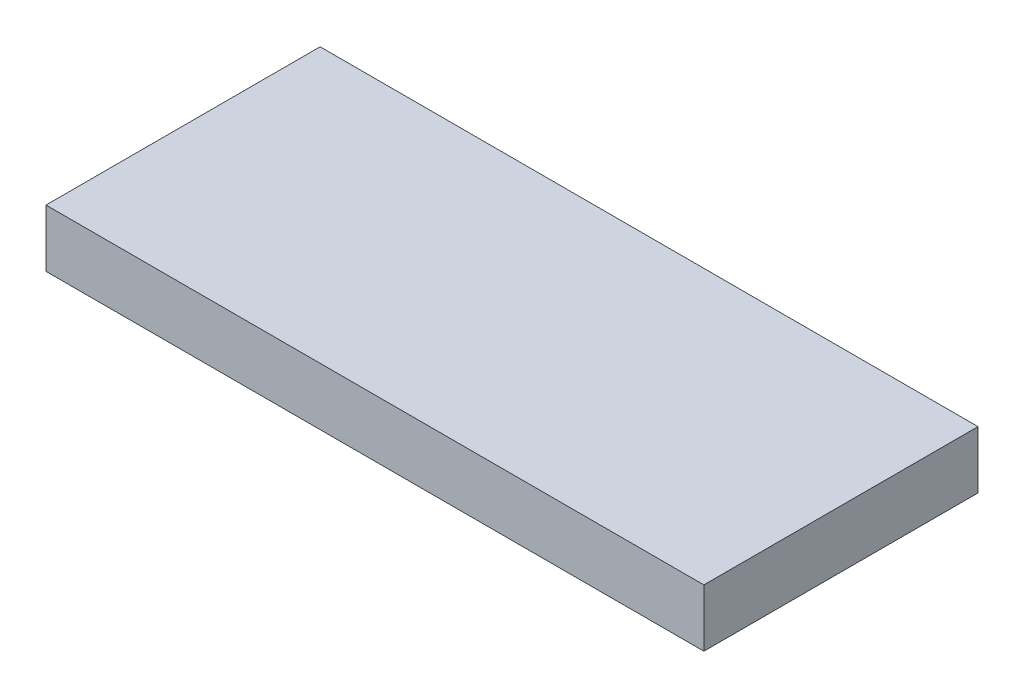
from build123d import *

# Parameters (mm, degrees)
SKETCH1_W           = 76.2
SKETCH1_H           = 31.75
BOSS_EXTRUDE1_DEPTH = 6.6548


with BuildPart() as part:
    # Sketch1 → Boss-Extrude1 (new body)
    with BuildSketch(Plane(origin=(0, 0, 0), x_dir=(1, 0, 0), z_dir=(0, 1, 0))):
        with Locations((38.1, 15.875)):
            Rectangle(SKETCH1_W, SKETCH1_H)
    extrude(amount=BOSS_EXTRUDE1_DEPTH)


solid = part.part
